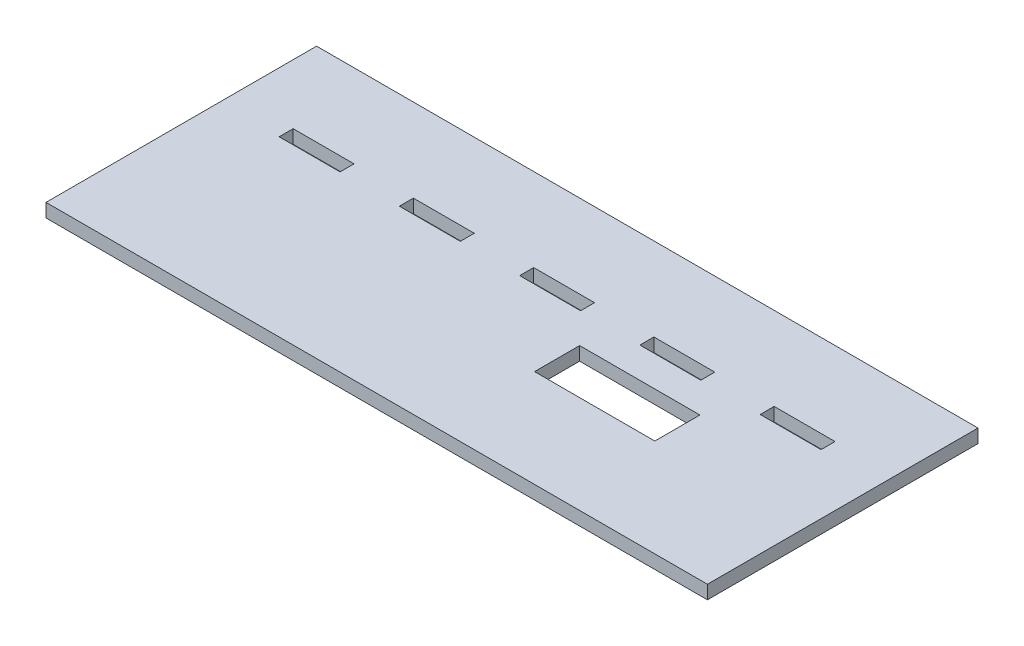
from build123d import *

# Parameters (mm, degrees)
SKETCH2_W            = 220
SKETCH2_H            = 90
BOSS_EXTRUDE1_DEPTH  = 4.5
SKETCH3_W            = 20.25
SKETCH3_H            = 4.65
CUT_EXTRUDE1_DEPTH   = 119.933805119
SKETCH4_W            = 40
SKETCH4_H            = 15
INPUT_LINK_CUT_DEPTH = 119.933805119


with BuildPart() as part:
    # Sketch2 → Boss-Extrude1 (new body)
    with BuildSketch(Plane(origin=(0, 0, 0), x_dir=(1, 0, 0), z_dir=(0, 1, 0))):
        Rectangle(SKETCH2_W, SKETCH2_H)
    extrude(amount=BOSS_EXTRUDE1_DEPTH)

    # Sketch3 → Cut-Extrude1 (cut, through all)
    with BuildSketch(Plane.XZ):
        with Locations((40, -15)):
            Rectangle(SKETCH3_W, SKETCH3_H)
        with Locations((0, -15)):
            Rectangle(SKETCH3_W, SKETCH3_H)
        with Locations((80, -15)):
            Rectangle(SKETCH3_W, SKETCH3_H)
        with Locations((-80, -15)):
            Rectangle(SKETCH3_W, SKETCH3_H)
        with Locations((-40, -15)):
            Rectangle(SKETCH3_W, SKETCH3_H)
    extrude(amount=-CUT_EXTRUDE1_DEPTH, mode=Mode.SUBTRACT)

    # Sketch4 → Input link cut (cut, through all)
    with BuildSketch(Plane.XZ):
        with Locations((40, 5)):
            Rectangle(SKETCH4_W, SKETCH4_H)
    extrude(amount=-INPUT_LINK_CUT_DEPTH, mode=Mode.SUBTRACT)


solid = part.part
